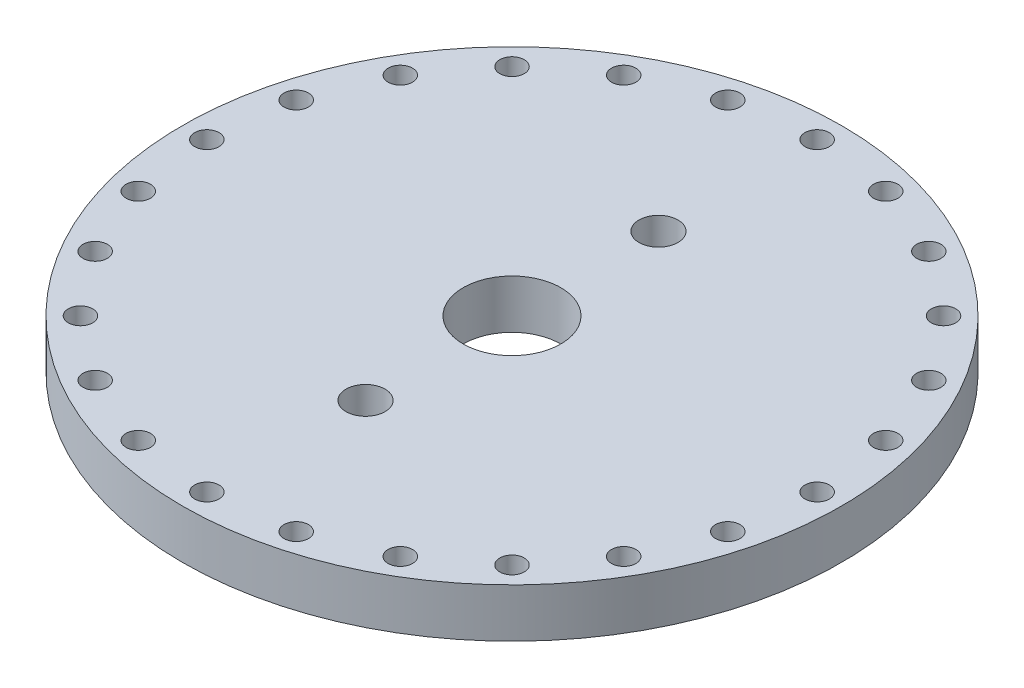
from build123d import *

# Parameters (mm, degrees)
SKETCH8_R           = 27
BOSS_EXTRUDE1_DEPTH = 4
CUT_EXTRUDE1_REACH  = 110.007
SKETCH6_R           = 4
CUT_EXTRUDE2_REACH  = 110.007
SKETCH7_R           = 1.6
CUT_EXTRUDE3_REACH  = 110.007
SKETCH9_R           = 1


with BuildPart() as part:
    # Sketch8 → Boss-Extrude1 (new body)
    with BuildSketch(Plane(origin=(0, 0, 0), x_dir=(1, 0, 0), z_dir=(0, 1, 0))):
        with Locations((49.061012395, 49.578499829)):
            Circle(SKETCH8_R)
    extrude(amount=BOSS_EXTRUDE1_DEPTH)

    # Sketch6 → Cut-Extrude1 (cut, up to next)
    with BuildSketch(Plane(origin=(0, 0, 0), x_dir=(1, 0, 0), z_dir=(0, 1, 0)), mode=Mode.PRIVATE) as cut_extrude1_sk1:
        with Locations((49.061012163, 49.578499597)):
            Circle(SKETCH6_R)
    cut_extrude1_tool1 = extrude(cut_extrude1_sk1.sketch, amount=CUT_EXTRUDE1_REACH, mode=Mode.PRIVATE) & part.part
    add(cut_extrude1_tool1.solids().sort_by_distance((49.061012, 0, -49.5785))[0], mode=Mode.SUBTRACT)

    # Sketch7 → Cut-Extrude2 (cut, up to next)
    with BuildSketch(Plane(origin=(0, 0, 0), x_dir=(1, 0, 0), z_dir=(0, 1, 0)), mode=Mode.PRIVATE) as cut_extrude2_sk1:
        with Locations((49.061012163, 61.578499829)):
            Circle(SKETCH7_R)
    cut_extrude2_tool1 = extrude(cut_extrude2_sk1.sketch, amount=CUT_EXTRUDE2_REACH, mode=Mode.PRIVATE) & part.part
    # Sketch7 → Cut-Extrude2 (cut, up to next)
    with BuildSketch(Plane(origin=(0, 0, 0), x_dir=(1, 0, 0), z_dir=(0, 1, 0)), mode=Mode.PRIVATE) as cut_extrude2_sk2:
        with Locations((49.061012163, 37.578499829)):
            Circle(SKETCH7_R)
    cut_extrude2_tool2 = extrude(cut_extrude2_sk2.sketch, amount=CUT_EXTRUDE2_REACH, mode=Mode.PRIVATE) & part.part
    add(cut_extrude2_tool1.solids().sort_by_distance((49.061012, 0, -61.5785))[0], mode=Mode.SUBTRACT)
    add(cut_extrude2_tool2.solids().sort_by_distance((49.061012, 0, -37.5785))[0], mode=Mode.SUBTRACT)

    # Sketch9 → Cut-Extrude3 (cut, up to next)
    with BuildSketch(Plane(origin=(0, 0, 0), x_dir=(1, 0, 0), z_dir=(0, 1, 0)), mode=Mode.PRIVATE) as cut_extrude3_sk1:
        with Locations((49.061012163, 74.578499829)):
            Circle(SKETCH9_R)
    cut_extrude3_tool1 = extrude(cut_extrude3_sk1.sketch, amount=CUT_EXTRUDE3_REACH, mode=Mode.PRIVATE) & part.part
    # Sketch9 → Cut-Extrude3 (cut, up to next)
    with BuildSketch(Plane(origin=(0, 0, 0), x_dir=(1, 0, 0), z_dir=(0, 1, 0)), mode=Mode.PRIVATE) as cut_extrude3_sk2:
        with Locations((55.531488291, 73.726645486)):
            Circle(SKETCH9_R)
    cut_extrude3_tool2 = extrude(cut_extrude3_sk2.sketch, amount=CUT_EXTRUDE3_REACH, mode=Mode.PRIVATE) & part.part
    # Sketch9 → Cut-Extrude3 (cut, up to next)
    with BuildSketch(Plane(origin=(0, 0, 0), x_dir=(1, 0, 0), z_dir=(0, 1, 0)), mode=Mode.PRIVATE) as cut_extrude3_sk3:
        with Locations((61.561012163, 71.229134924)):
            Circle(SKETCH9_R)
    cut_extrude3_tool3 = extrude(cut_extrude3_sk3.sketch, amount=CUT_EXTRUDE3_REACH, mode=Mode.PRIVATE) & part.part
    # Sketch9 → Cut-Extrude3 (cut, up to next)
    with BuildSketch(Plane(origin=(0, 0, 0), x_dir=(1, 0, 0), z_dir=(0, 1, 0)), mode=Mode.PRIVATE) as cut_extrude3_sk4:
        with Locations((66.738681693, 67.256169359)):
            Circle(SKETCH9_R)
    cut_extrude3_tool4 = extrude(cut_extrude3_sk4.sketch, amount=CUT_EXTRUDE3_REACH, mode=Mode.PRIVATE) & part.part
    # Sketch9 → Cut-Extrude3 (cut, up to next)
    with BuildSketch(Plane(origin=(0, 0, 0), x_dir=(1, 0, 0), z_dir=(0, 1, 0)), mode=Mode.PRIVATE) as cut_extrude3_sk5:
        with Locations((70.711647258, 62.078499829)):
            Circle(SKETCH9_R)
    cut_extrude3_tool5 = extrude(cut_extrude3_sk5.sketch, amount=CUT_EXTRUDE3_REACH, mode=Mode.PRIVATE) & part.part
    # Sketch9 → Cut-Extrude3 (cut, up to next)
    with BuildSketch(Plane(origin=(0, 0, 0), x_dir=(1, 0, 0), z_dir=(0, 1, 0)), mode=Mode.PRIVATE) as cut_extrude3_sk6:
        with Locations((73.20915782, 56.048975957)):
            Circle(SKETCH9_R)
    cut_extrude3_tool6 = extrude(cut_extrude3_sk6.sketch, amount=CUT_EXTRUDE3_REACH, mode=Mode.PRIVATE) & part.part
    # Sketch9 → Cut-Extrude3 (cut, up to next)
    with BuildSketch(Plane(origin=(0, 0, 0), x_dir=(1, 0, 0), z_dir=(0, 1, 0)), mode=Mode.PRIVATE) as cut_extrude3_sk7:
        with Locations((74.061012163, 49.578499829)):
            Circle(SKETCH9_R)
    cut_extrude3_tool7 = extrude(cut_extrude3_sk7.sketch, amount=CUT_EXTRUDE3_REACH, mode=Mode.PRIVATE) & part.part
    # Sketch9 → Cut-Extrude3 (cut, up to next)
    with BuildSketch(Plane(origin=(0, 0, 0), x_dir=(1, 0, 0), z_dir=(0, 1, 0)), mode=Mode.PRIVATE) as cut_extrude3_sk8:
        with Locations((73.20915782, 43.108023702)):
            Circle(SKETCH9_R)
    cut_extrude3_tool8 = extrude(cut_extrude3_sk8.sketch, amount=CUT_EXTRUDE3_REACH, mode=Mode.PRIVATE) & part.part
    # Sketch9 → Cut-Extrude3 (cut, up to next)
    with BuildSketch(Plane(origin=(0, 0, 0), x_dir=(1, 0, 0), z_dir=(0, 1, 0)), mode=Mode.PRIVATE) as cut_extrude3_sk9:
        with Locations((70.711647258, 37.078499829)):
            Circle(SKETCH9_R)
    cut_extrude3_tool9 = extrude(cut_extrude3_sk9.sketch, amount=CUT_EXTRUDE3_REACH, mode=Mode.PRIVATE) & part.part
    # Sketch9 → Cut-Extrude3 (cut, up to next)
    with BuildSketch(Plane(origin=(0, 0, 0), x_dir=(1, 0, 0), z_dir=(0, 1, 0)), mode=Mode.PRIVATE) as cut_extrude3_sk10:
        with Locations((66.738681693, 31.9008303)):
            Circle(SKETCH9_R)
    cut_extrude3_tool10 = extrude(cut_extrude3_sk10.sketch, amount=CUT_EXTRUDE3_REACH, mode=Mode.PRIVATE) & part.part
    # Sketch9 → Cut-Extrude3 (cut, up to next)
    with BuildSketch(Plane(origin=(0, 0, 0), x_dir=(1, 0, 0), z_dir=(0, 1, 0)), mode=Mode.PRIVATE) as cut_extrude3_sk11:
        with Locations((61.561012163, 27.927864735)):
            Circle(SKETCH9_R)
    cut_extrude3_tool11 = extrude(cut_extrude3_sk11.sketch, amount=CUT_EXTRUDE3_REACH, mode=Mode.PRIVATE) & part.part
    # Sketch9 → Cut-Extrude3 (cut, up to next)
    with BuildSketch(Plane(origin=(0, 0, 0), x_dir=(1, 0, 0), z_dir=(0, 1, 0)), mode=Mode.PRIVATE) as cut_extrude3_sk12:
        with Locations((55.531488291, 25.430354172)):
            Circle(SKETCH9_R)
    cut_extrude3_tool12 = extrude(cut_extrude3_sk12.sketch, amount=CUT_EXTRUDE3_REACH, mode=Mode.PRIVATE) & part.part
    # Sketch9 → Cut-Extrude3 (cut, up to next)
    with BuildSketch(Plane(origin=(0, 0, 0), x_dir=(1, 0, 0), z_dir=(0, 1, 0)), mode=Mode.PRIVATE) as cut_extrude3_sk13:
        with Locations((49.061012163, 24.578499829)):
            Circle(SKETCH9_R)
    cut_extrude3_tool13 = extrude(cut_extrude3_sk13.sketch, amount=CUT_EXTRUDE3_REACH, mode=Mode.PRIVATE) & part.part
    # Sketch9 → Cut-Extrude3 (cut, up to next)
    with BuildSketch(Plane(origin=(0, 0, 0), x_dir=(1, 0, 0), z_dir=(0, 1, 0)), mode=Mode.PRIVATE) as cut_extrude3_sk14:
        with Locations((42.590536036, 25.430354172)):
            Circle(SKETCH9_R)
    cut_extrude3_tool14 = extrude(cut_extrude3_sk14.sketch, amount=CUT_EXTRUDE3_REACH, mode=Mode.PRIVATE) & part.part
    # Sketch9 → Cut-Extrude3 (cut, up to next)
    with BuildSketch(Plane(origin=(0, 0, 0), x_dir=(1, 0, 0), z_dir=(0, 1, 0)), mode=Mode.PRIVATE) as cut_extrude3_sk15:
        with Locations((36.561012163, 27.927864735)):
            Circle(SKETCH9_R)
    cut_extrude3_tool15 = extrude(cut_extrude3_sk15.sketch, amount=CUT_EXTRUDE3_REACH, mode=Mode.PRIVATE) & part.part
    # Sketch9 → Cut-Extrude3 (cut, up to next)
    with BuildSketch(Plane(origin=(0, 0, 0), x_dir=(1, 0, 0), z_dir=(0, 1, 0)), mode=Mode.PRIVATE) as cut_extrude3_sk16:
        with Locations((31.383342634, 31.9008303)):
            Circle(SKETCH9_R)
    cut_extrude3_tool16 = extrude(cut_extrude3_sk16.sketch, amount=CUT_EXTRUDE3_REACH, mode=Mode.PRIVATE) & part.part
    # Sketch9 → Cut-Extrude3 (cut, up to next)
    with BuildSketch(Plane(origin=(0, 0, 0), x_dir=(1, 0, 0), z_dir=(0, 1, 0)), mode=Mode.PRIVATE) as cut_extrude3_sk17:
        with Locations((27.410377069, 37.078499829)):
            Circle(SKETCH9_R)
    cut_extrude3_tool17 = extrude(cut_extrude3_sk17.sketch, amount=CUT_EXTRUDE3_REACH, mode=Mode.PRIVATE) & part.part
    # Sketch9 → Cut-Extrude3 (cut, up to next)
    with BuildSketch(Plane(origin=(0, 0, 0), x_dir=(1, 0, 0), z_dir=(0, 1, 0)), mode=Mode.PRIVATE) as cut_extrude3_sk18:
        with Locations((24.912866506, 43.108023702)):
            Circle(SKETCH9_R)
    cut_extrude3_tool18 = extrude(cut_extrude3_sk18.sketch, amount=CUT_EXTRUDE3_REACH, mode=Mode.PRIVATE) & part.part
    # Sketch9 → Cut-Extrude3 (cut, up to next)
    with BuildSketch(Plane(origin=(0, 0, 0), x_dir=(1, 0, 0), z_dir=(0, 1, 0)), mode=Mode.PRIVATE) as cut_extrude3_sk19:
        with Locations((24.061012163, 49.578499829)):
            Circle(SKETCH9_R)
    cut_extrude3_tool19 = extrude(cut_extrude3_sk19.sketch, amount=CUT_EXTRUDE3_REACH, mode=Mode.PRIVATE) & part.part
    # Sketch9 → Cut-Extrude3 (cut, up to next)
    with BuildSketch(Plane(origin=(0, 0, 0), x_dir=(1, 0, 0), z_dir=(0, 1, 0)), mode=Mode.PRIVATE) as cut_extrude3_sk20:
        with Locations((24.912866506, 56.048975957)):
            Circle(SKETCH9_R)
    cut_extrude3_tool20 = extrude(cut_extrude3_sk20.sketch, amount=CUT_EXTRUDE3_REACH, mode=Mode.PRIVATE) & part.part
    # Sketch9 → Cut-Extrude3 (cut, up to next)
    with BuildSketch(Plane(origin=(0, 0, 0), x_dir=(1, 0, 0), z_dir=(0, 1, 0)), mode=Mode.PRIVATE) as cut_extrude3_sk21:
        with Locations((27.410377069, 62.078499829)):
            Circle(SKETCH9_R)
    cut_extrude3_tool21 = extrude(cut_extrude3_sk21.sketch, amount=CUT_EXTRUDE3_REACH, mode=Mode.PRIVATE) & part.part
    # Sketch9 → Cut-Extrude3 (cut, up to next)
    with BuildSketch(Plane(origin=(0, 0, 0), x_dir=(1, 0, 0), z_dir=(0, 1, 0)), mode=Mode.PRIVATE) as cut_extrude3_sk22:
        with Locations((31.383342634, 67.256169359)):
            Circle(SKETCH9_R)
    cut_extrude3_tool22 = extrude(cut_extrude3_sk22.sketch, amount=CUT_EXTRUDE3_REACH, mode=Mode.PRIVATE) & part.part
    # Sketch9 → Cut-Extrude3 (cut, up to next)
    with BuildSketch(Plane(origin=(0, 0, 0), x_dir=(1, 0, 0), z_dir=(0, 1, 0)), mode=Mode.PRIVATE) as cut_extrude3_sk23:
        with Locations((36.561012163, 71.229134924)):
            Circle(SKETCH9_R)
    cut_extrude3_tool23 = extrude(cut_extrude3_sk23.sketch, amount=CUT_EXTRUDE3_REACH, mode=Mode.PRIVATE) & part.part
    # Sketch9 → Cut-Extrude3 (cut, up to next)
    with BuildSketch(Plane(origin=(0, 0, 0), x_dir=(1, 0, 0), z_dir=(0, 1, 0)), mode=Mode.PRIVATE) as cut_extrude3_sk24:
        with Locations((42.590536036, 73.726645486)):
            Circle(SKETCH9_R)
    cut_extrude3_tool24 = extrude(cut_extrude3_sk24.sketch, amount=CUT_EXTRUDE3_REACH, mode=Mode.PRIVATE) & part.part
    add(cut_extrude3_tool1.solids().sort_by_distance((49.061012, 0, -74.5785))[0], mode=Mode.SUBTRACT)
    add(cut_extrude3_tool2.solids().sort_by_distance((55.531488, 0, -73.726645))[0], mode=Mode.SUBTRACT)
    add(cut_extrude3_tool3.solids().sort_by_distance((61.561012, 0, -71.229135))[0], mode=Mode.SUBTRACT)
    add(cut_extrude3_tool4.solids().sort_by_distance((66.738682, 0, -67.256169))[0], mode=Mode.SUBTRACT)
    add(cut_extrude3_tool5.solids().sort_by_distance((70.711647, 0, -62.0785))[0], mode=Mode.SUBTRACT)
    add(cut_extrude3_tool6.solids().sort_by_distance((73.209158, 0, -56.048976))[0], mode=Mode.SUBTRACT)
    add(cut_extrude3_tool7.solids().sort_by_distance((74.061012, 0, -49.5785))[0], mode=Mode.SUBTRACT)
    add(cut_extrude3_tool8.solids().sort_by_distance((73.209158, 0, -43.108024))[0], mode=Mode.SUBTRACT)
    add(cut_extrude3_tool9.solids().sort_by_distance((70.711647, 0, -37.0785))[0], mode=Mode.SUBTRACT)
    add(cut_extrude3_tool10.solids().sort_by_distance((66.738682, 0, -31.90083))[0], mode=Mode.SUBTRACT)
    add(cut_extrude3_tool11.solids().sort_by_distance((61.561012, 0, -27.927865))[0], mode=Mode.SUBTRACT)
    add(cut_extrude3_tool12.solids().sort_by_distance((55.531488, 0, -25.430354))[0], mode=Mode.SUBTRACT)
    add(cut_extrude3_tool13.solids().sort_by_distance((49.061012, 0, -24.5785))[0], mode=Mode.SUBTRACT)
    add(cut_extrude3_tool14.solids().sort_by_distance((42.590536, 0, -25.430354))[0], mode=Mode.SUBTRACT)
    add(cut_extrude3_tool15.solids().sort_by_distance((36.561012, 0, -27.927865))[0], mode=Mode.SUBTRACT)
    add(cut_extrude3_tool16.solids().sort_by_distance((31.383343, 0, -31.90083))[0], mode=Mode.SUBTRACT)
    add(cut_extrude3_tool17.solids().sort_by_distance((27.410377, 0, -37.0785))[0], mode=Mode.SUBTRACT)
    add(cut_extrude3_tool18.solids().sort_by_distance((24.912867, 0, -43.108024))[0], mode=Mode.SUBTRACT)
    add(cut_extrude3_tool19.solids().sort_by_distance((24.061012, 0, -49.5785))[0], mode=Mode.SUBTRACT)
    add(cut_extrude3_tool20.solids().sort_by_distance((24.912867, 0, -56.048976))[0], mode=Mode.SUBTRACT)
    add(cut_extrude3_tool21.solids().sort_by_distance((27.410377, 0, -62.0785))[0], mode=Mode.SUBTRACT)
    add(cut_extrude3_tool22.solids().sort_by_distance((31.383343, 0, -67.256169))[0], mode=Mode.SUBTRACT)
    add(cut_extrude3_tool23.solids().sort_by_distance((36.561012, 0, -71.229135))[0], mode=Mode.SUBTRACT)
    add(cut_extrude3_tool24.solids().sort_by_distance((42.590536, 0, -73.726645))[0], mode=Mode.SUBTRACT)


solid = part.part
